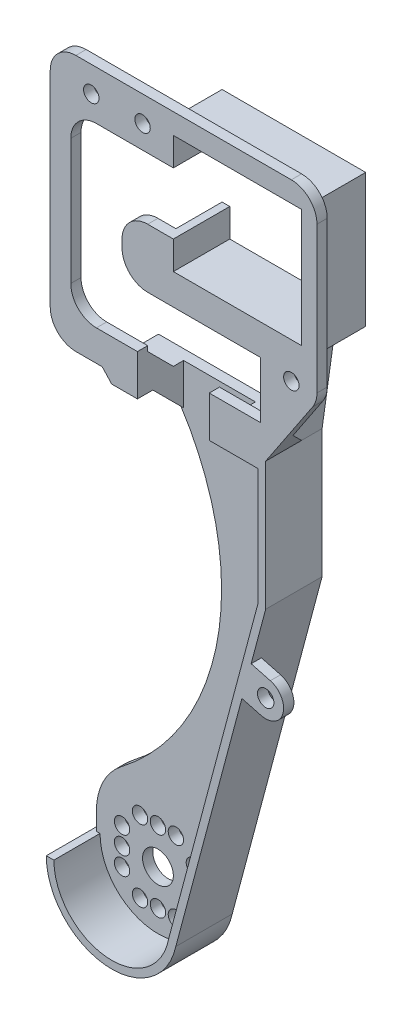
from build123d import *

# Parameters (mm, degrees)
EXTRUDE_1_DEPTH                 = 52
CUT_EXTRUDE_1_REACH             = 161.013
CUT_EXTRUDE_1_DIRECTION_2_DEPTH = 7
SKETCH_3_R                      = 1.5
SKETCH_3_R_2                    = 3
CUT_EXTRUDE_2_DEPTH             = 160.138304628
FILLET_1_R                      = 5
CHAMFER_1_SIZE                  = 5
FILLET_2_R                      = 12.5
EXTRUDE_2_DEPTH                 = 9
EXTRUDE_3_DEPTH                 = 9
EXTRUDE_3_DEPTH_BACK            = 2
CHAMFER_3_SIZE                  = 6
EXTRUDE_START                   = -11
SKETCH_7_R                      = 1.6
EXTRUDE_4_DEPTH                 = 2


with BuildPart() as part:
    # 草图1 → 凸台-拉伸1 (new body)
    with BuildSketch(Plane(origin=(0, 0, 0), x_dir=(0, 0, -1), z_dir=(1, 0, 0))):
        Polygon((0, 0), (0, 98), (-9, 98), (-9, 150), (-7, 150), (-7, 100), (2, 100), (2, 0), align=None)
    extrude(amount=EXTRUDE_1_DEPTH)

    # 草图2 → 切除-拉伸1 (cut, up to next)
    with BuildSketch(Plane(origin=(0, 0, 7), x_dir=(-1, 0, 0), z_dir=(0, 0, -1)), mode=Mode.PRIVATE) as cut_extrude_1_sk1:
        Polygon((-49, 146), (-49, 123), (-24, 123), (-24, 128.5), (-14, 128.5), (-14, 117), (-41, 117), (-41, 106), (-31, 106), (-31, 98), (-17, 98), (-17, 106), (-4, 106), (-4, 140.5), (-24, 140.5), (-24, 146), align=None)
    cut_extrude_1_tool1 = extrude(cut_extrude_1_sk1.sketch, amount=-CUT_EXTRUDE_1_REACH, mode=Mode.PRIVATE) & part.part
    add(cut_extrude_1_tool1.solids().sort_by_distance((25.692202, 124.595066, 7))[0], mode=Mode.SUBTRACT)

    # 草图2 → 切除-拉伸1 direction 2 (cut)
    with BuildSketch(Plane(origin=(0, 0, 7), x_dir=(-1, 0, 0), z_dir=(0, 0, -1))):
        Polygon((-49, 146), (-49, 123), (-24, 123), (-24, 128.5), (-14, 128.5), (-14, 117), (-41, 117), (-41, 106), (-31, 106), (-31, 98), (-17, 98), (-17, 106), (-4, 106), (-4, 140.5), (-24, 140.5), (-24, 146), align=None)
    extrude(amount=CUT_EXTRUDE_1_DIRECTION_2_DEPTH, mode=Mode.SUBTRACT)

    # 草图3 → 切除-拉伸2 (cut, through all)
    with BuildSketch(Plane(origin=(0, 0, -2), x_dir=(-1, 0, 0), z_dir=(0, 0, -1))):
        with Locations(Location((-15.5, 19, 0), (0, 0, 90))):
            Circle(SKETCH_3_R)
        with Locations(Location((-12, 19, 0), (0, 0, 90))):
            Circle(SKETCH_3_R)
        with Locations(Location((-8.5, 19, 0), (0, 0, 90))):
            Circle(SKETCH_3_R)
        with Locations(Location((-8.5, 5, 0), (0, 0, 90))):
            Circle(SKETCH_3_R)
        with Locations(Location((-12, 5, 0), (0, 0, 90))):
            Circle(SKETCH_3_R)
        with Locations(Location((-15.5, 5, 0), (0, 0, 90))):
            Circle(SKETCH_3_R)
        with Locations(Location((-5, 15.5, 0), (0, 0, 90))):
            Circle(SKETCH_3_R)
        with Locations(Location((-5, 12, 0), (0, 0, 90))):
            Circle(SKETCH_3_R)
        with Locations(Location((-5, 8.5, 0), (0, 0, 90))):
            Circle(SKETCH_3_R)
        with Locations(Location((-19, 8.5, 0), (0, 0, 90))):
            Circle(SKETCH_3_R)
        with Locations(Location((-19, 12, 0), (0, 0, 90))):
            Circle(SKETCH_3_R)
        with Locations(Location((-19, 15.5, 0), (0, 0, 90))):
            Circle(SKETCH_3_R)
        with Locations(Location((-8, 145, 0), (0, 0, 90))):
            Circle(SKETCH_3_R)
        with Locations(Location((-47, 116, 0), (0, 0, 90))):
            Circle(SKETCH_3_R)
        with Locations(Location((-18, 145, 0), (0, 0, 90))):
            Circle(SKETCH_3_R)
        with Locations(Location((-12, 12, 0), (0, 0, 90))):
            Circle(SKETCH_3_R_2)
        Polygon((-42, 75), (-22, 0), (-52, 0), (-52, 115), (-42, 100), align=None)
        with BuildLine():
            Line((0, 100), (-10.111173925, 100))
            ThreePointArc((-10.111173925, 100), (-23.988643866, 58.568340451), (0, 22.048324701))
            Line((0, 22.048324701), (0, 100))
        make_face()
    extrude(amount=-CUT_EXTRUDE_2_DEPTH, mode=Mode.SUBTRACT)

    # 圆角1
    fillet_1_edges = [part.edges().sort_by_distance(p)[0] for p in [
        (0, 100, 8),
        (52, 115, 8),
        (52, 150, 8),
        (14, 128.5, 8),
        (14, 117, 8),
        (4, 106, 8),
        (4, 140.5, 8),
        (0, 150, 8),
    ]]
    fillet(fillet_1_edges, radius=FILLET_1_R)

    # 倒角1
    chamfer_1_edges = [part.edges().sort_by_distance(p)[0] for p in [
        (36.5, 100, 7),
        (13.555586963, 100, 7),
    ]]
    chamfer(chamfer_1_edges, length=CHAMFER_1_SIZE)

    # 圆角2
    # the kernel refuses this fillet: 12.5 mm, written as the material it takes off along each edge
    with BuildSketch(Plane(origin=(22, 0, -26.008697284), x_dir=(0.2576626505603326, 0.9662349396012463, 0), z_dir=(0, 0, 1))) as fillet_2_piece_1:
        with BuildLine():
            CenterArc((FILLET_2_R * 0.768278313084, FILLET_2_R), FILLET_2_R, 194.931417178, 75.068582822)
            Line((-FILLET_2_R * 0.197956626517, FILLET_2_R * 0.74233734944), (0, 0))
            Line((0, 0), (FILLET_2_R * 0.768278313084, 0))
        make_face()
    extrude(amount=50.017394568, mode=Mode.SUBTRACT)
    with BuildSketch(Plane(origin=(0, 0, -33.25), x_dir=(1, 0, 0), z_dir=(0, 0, 1))) as fillet_2_piece_2:
        with BuildLine():
            CenterArc((FILLET_2_R, FILLET_2_R), FILLET_2_R, 180, 90)
            Line((0, FILLET_2_R), (0, 0))
            Line((0, 0), (FILLET_2_R, 0))
        make_face()
    extrude(amount=64.5, mode=Mode.SUBTRACT)
    with BuildSketch(Plane(origin=(0, 22.048324701, -18.489371261), x_dir=(0.8273370938030895, 0.561705735432226, 0), z_dir=(0, 0, 1))) as fillet_2_piece_3:
        with BuildLine():
            CenterArc((6.636843908, -12.478229092), FILLET_2_R, 93.382080567, 52.444076451)
            Line((-3.704869764, -5.456907399), (0, 0))
            ThreePointArc((0, 0), (2.949708404, -0.087083632), (5.899416807, 0))
        make_face()
    extrude(amount=34.978742522, mode=Mode.SUBTRACT)

    # 草图4 → 凸台-拉伸2 (add)
    with BuildSketch(Plane(origin=(0, 0, 7), x_dir=(-1, 0, 0), z_dir=(0, 0, -1))):
        Polygon((-24, 128.5), (-24, 123), (-49, 123), (-49, 146), (-24, 146), (-24, 140.5), (-22.5, 140.5), (-22.5, 147.5), (-50.5, 147.5), (-50.5, 121.5), (-45, 121.5), (-42, 100), (-40.485467906, 100), (-43.485467906, 121.5), (-22.5, 121.5), (-22.5, 128.5), align=None)
    extrude(amount=EXTRUDE_2_DEPTH)

    # 草图6 → 凸台-拉伸3 (add, two sides: drawn at the far end of the back side and taken through both)
    with BuildSketch(Plane.XY.offset(-EXTRUDE_3_DEPTH_BACK)):
        with BuildLine():
            Line((42, 98), (42, 75))
            Line((42, 75), (24.474457831, 9.279216868))
            ThreePointArc((24.474457831, 9.279216868), (10.631728691, -0.694195235), (-0.76772333, 12))
            Line((-0.76772333, 12), (0.709641329, 12))
            ThreePointArc((0.709641329, 12), (10.981525419, 0.755672166), (23.10661066, 9.971355488))
            Line((23.10661066, 9.971355488), (40.5, 75.196565511))
            Line((40.5, 75.196565511), (40.5, 98))
            Line((40.5, 98), (42, 98))
        make_face()
    extrude(amount=EXTRUDE_3_DEPTH + EXTRUDE_3_DEPTH_BACK)

    # 倒角3
    chamfer_3_edges = [part.edges().sort_by_distance(p)[0] for p in [
        (14.483655862, 98, 0),
        (35.75, 98, 0),
    ]]
    chamfer(chamfer_3_edges, length=CHAMFER_3_SIZE)

    # 草图7 → 凸台-拉伸4 (add)
    with BuildSketch(Plane(origin=(0, 0, -2), x_dir=(-1, 0, 0), z_dir=(0, 0, -1)).offset(EXTRUDE_START)):
        with BuildLine():
            Line((-39.167379443, 64.377672911), (-42.901819277, 63.381822289))
            ThreePointArc((-42.901819277, 63.381822289), (-45.381822289, 59.098180723), (-41.098180723, 56.618177711))
            Line((-41.098180723, 56.618177711), (-37.363740889, 57.614028334))
            Line((-37.363740889, 57.614028334), (-39.167379443, 64.377672911))
        make_face()
        with Locations(Location((-42, 60, 0), (0, 0, 90))):
            Circle(SKETCH_7_R, mode=Mode.SUBTRACT)
    extrude(amount=EXTRUDE_4_DEPTH)


solid = part.part
